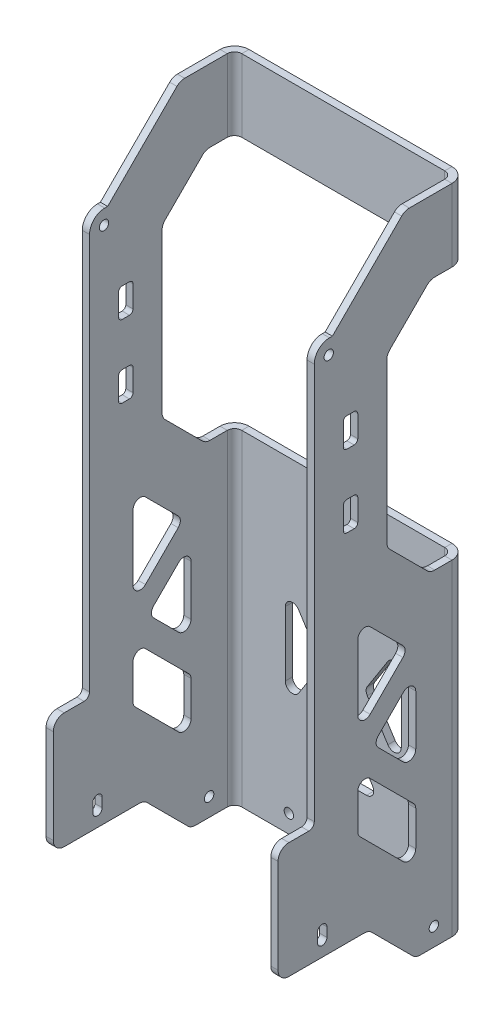
from build123d import *

# Parameters (mm, degrees)
BASE_FLANGE1_DEPTH      = 180
CUT_EXTRUDE2_DEPTH      = 188.584647559
CUT_EXTRUDE2_DEPTH_BACK = 188.584647559
CUT_EXTRUDE3_DEPTH      = 188.584647559
CUT_EXTRUDE3_DEPTH_BACK = 188.584647559
SKETCH9_R               = 1.3
FILLET1_R               = 4.2
SKETCH11_W              = 2
SKETCH11_H              = 32
BOSS_EXTRUDE1_DEPTH     = 10
FILLET5_R               = 3
FILLET6_R               = 1.5
CUT_EXTRUDE4_DEPTH      = 188.584647559
CUT_EXTRUDE4_DEPTH_BACK = 188.584647559
SKETCH13_R              = 1.3
CUT_EXTRUDE5_DEPTH      = 10
CUT_EXTRUDE6_DEPTH      = 188.584647559
CUT_EXTRUDE6_DEPTH_BACK = 188.584647559
SKETCH14_R              = 1.3
CUT_EXTRUDE8_DEPTH      = 188.584647559
CUT_EXTRUDE8_DEPTH_BACK = 188.584647559
SKETCH15_W              = 4
SKETCH15_H              = 8
CUT_EXTRUDE9_DEPTH      = 188.584647559
CUT_EXTRUDE9_DEPTH_BACK = 188.584647559
FILLET7_R               = 2
CUT_EXTRUDE10_DEPTH     = 10
FILLET8_R               = 2
FILLET9_R               = 1


# Sheet-metal steps are written as plain solids
with BuildPart() as part:
    # Sketch1 → Base-Flange1 (new body)
    with BuildSketch(Plane(origin=(0, 0, 0), x_dir=(1, 0, 0), z_dir=(0, 1, 0))):
        with BuildLine():
            Line((-30, 0), (-30, 38))
            ThreePointArc((-30, 38), (-29.414213562, 39.414213562), (-28, 40))
            Line((-28, 40), (28, 40))
            ThreePointArc((28, 40), (29.414213562, 39.414213562), (30, 38))
            Line((30, 38), (30, 0))
            Line((30, 0), (32, 0))
            Line((32, 0), (32, 38))
            ThreePointArc((32, 38), (30.828427125, 40.828427125), (28, 42))
            Line((28, 42), (-28, 42))
            ThreePointArc((-28, 42), (-30.828427125, 40.828427125), (-32, 38))
            Line((-32, 38), (-32, 0))
            Line((-32, 0), (-30, 0))
        make_face()
    extrude(amount=BASE_FLANGE1_DEPTH)

    # Sketch6 → Cut-Extrude2 (cut, two sides: drawn at the far end of the back side and taken through both)
    with BuildSketch(Plane(origin=(0, 0, 0), x_dir=(0, 0, -1), z_dir=(1, 0, 0)).offset(-CUT_EXTRUDE2_DEPTH_BACK)):
        Polygon((0, 13), (15, 13), (28, 0), (0, 0), align=None)
        Polygon((42, 160), (32, 160), (20, 148), (20, 102), (32, 90), (42, 90), align=None)
        Polygon((0, 160), (5, 160), (25, 180), (0, 180), align=None)
    extrude(amount=CUT_EXTRUDE2_DEPTH + CUT_EXTRUDE2_DEPTH_BACK, mode=Mode.SUBTRACT)

    # Sketch9 → Cut-Extrude3 (cut, two sides: drawn at the far end of the back side and taken through both)
    with BuildSketch(Plane(origin=(0, 0, 0), x_dir=(0, 0, -1), z_dir=(1, 0, 0)).offset(-CUT_EXTRUDE3_DEPTH_BACK)):
        with Locations((4, 156)):
            Circle(SKETCH9_R)
    extrude(amount=CUT_EXTRUDE3_DEPTH + CUT_EXTRUDE3_DEPTH_BACK, mode=Mode.SUBTRACT)

    # Fillet1
    fillet1_edges = [part.edges().sort_by_distance(p)[0] for p in [
        (31, 160, 0),
        (-31, 160, 0),
    ]]
    fillet(fillet1_edges, radius=FILLET1_R)

    # Sketch11 → Boss-Extrude1 (add)
    with BuildSketch(Plane.XY):
        with Locations((-31, 29)):
            Rectangle(SKETCH11_W, SKETCH11_H)
        with Locations((31, 29)):
            Rectangle(SKETCH11_W, SKETCH11_H)
    extrude(amount=BOSS_EXTRUDE1_DEPTH)

    # Fillet5
    fillet5_edges = [part.edges().sort_by_distance(p)[0] for p in [
        (-31, 102, -20),
        (-31, 148, -20),
        (-31, 160, -32),
        (31, 180, -25),
        (-31, 0, -28),
        (-31, 13, -15),
        (31, 0, -28),
        (31, 13, -15),
        (-31, 180, -25),
        (-31, 13, 10),
        (-31, 45, 10),
        (31, 13, 10),
        (31, 45, 10),
        (31, 102, -20),
        (31, 148, -20),
        (31, 160, -32),
        (31, 90, -32),
        (-31, 90, -32),
    ]]
    fillet(fillet5_edges, radius=FILLET5_R)

    # Fillet6
    fillet6_edges = [part.edges().sort_by_distance(p)[0] for p in [
        (-31, 45, 0),
        (31, 45, 0),
    ]]
    fillet(fillet6_edges, radius=FILLET6_R)

    # Sketch12 → Cut-Extrude4 (cut, two sides: drawn at the far end of the back side and taken through both)
    with BuildSketch(Plane(origin=(0, 0, 0), x_dir=(0, 0, -1), z_dir=(1, 0, 0)).offset(-CUT_EXTRUDE4_DEPTH_BACK)):
        with BuildLine():
            Line((3.5, 19.6), (3.5, 17.1))
            ThreePointArc((3.5, 17.1), (2.2, 15.8), (0.9, 17.1))
            Line((0.9, 17.1), (0.9, 19.6))
            ThreePointArc((0.9, 19.6), (2.2, 20.9), (3.5, 19.6))
        make_face()
    extrude(amount=CUT_EXTRUDE4_DEPTH + CUT_EXTRUDE4_DEPTH_BACK, mode=Mode.SUBTRACT)

    # Sketch13 → Cut-Extrude5 (cut)
    with BuildSketch(Plane(origin=(0, 0, -42), x_dir=(-1, 0, 0), z_dir=(0, 0, -1))):
        with Locations((-15, 5)):
            Circle(SKETCH13_R)
        with Locations((15, 5)):
            Circle(SKETCH13_R)
    extrude(amount=-CUT_EXTRUDE5_DEPTH, mode=Mode.SUBTRACT)

    # Sketch14 → Cut-Extrude6 (cut, two sides: drawn at the far end of the back side and taken through both)
    with BuildSketch(Plane(origin=(0, 0, 0), x_dir=(0, 0, -1), z_dir=(1, 0, 0)).offset(-CUT_EXTRUDE6_DEPTH_BACK)):
        with Locations((33, 5)):
            Circle(SKETCH14_R)
    extrude(amount=CUT_EXTRUDE6_DEPTH + CUT_EXTRUDE6_DEPTH_BACK, mode=Mode.SUBTRACT)

    # Sketch15 → Cut-Extrude8 (cut, two sides: drawn at the far end of the back side and taken through both)
    with BuildSketch(Plane(origin=(0, 0, 0), x_dir=(0, 0, -1), z_dir=(1, 0, 0)).offset(-CUT_EXTRUDE8_DEPTH_BACK)):
        with Locations((10, 135)):
            Rectangle(SKETCH15_W, SKETCH15_H)
        with Locations((10, 115)):
            Rectangle(SKETCH15_W, SKETCH15_H)
    extrude(amount=CUT_EXTRUDE8_DEPTH + CUT_EXTRUDE8_DEPTH_BACK, mode=Mode.SUBTRACT)

    # Sketch16 → Cut-Extrude9 (cut, two sides: drawn at the far end of the back side and taken through both)
    with BuildSketch(Plane(origin=(0, 0, 0), x_dir=(0, 0, -1), z_dir=(1, 0, 0)).offset(-CUT_EXTRUDE9_DEPTH_BACK)):
        Polygon((25.878679656, 74.908116908), (12, 88.786796564), (12, 61.029437252), align=None)
        Polygon((28, 68.544155877), (16.242640687, 56.786796564), (28, 45.029437252), align=None)
        Polygon((28, 36.544155877), (12, 52.544155877), (12, 37.213203436), (28, 21.213203436), align=None)
    extrude(amount=CUT_EXTRUDE9_DEPTH + CUT_EXTRUDE9_DEPTH_BACK, mode=Mode.SUBTRACT)

    # Fillet7
    fillet7_edges = [part.edges().sort_by_distance(p)[0] for p in [
        (31, 45.029437252, -28),
        (-31, 45.029437252, -28),
        (31, 56.786796564, -16.242640687),
        (-31, 56.786796564, -16.242640687),
        (31, 68.544155877, -28),
        (-31, 68.544155877, -28),
        (31, 52.544155877, -12),
        (-31, 52.544155877, -12),
        (31, 36.544155877, -28),
        (-31, 36.544155877, -28),
        (31, 21.213203436, -28),
        (-31, 21.213203436, -28),
        (31, 37.213203436, -12),
        (-31, 37.213203436, -12),
        (31, 74.908116908, -25.878679656),
        (-31, 74.908116908, -25.878679656),
        (31, 61.029437252, -12),
        (-31, 61.029437252, -12),
        (31, 88.786796564, -12),
        (-31, 88.786796564, -12),
    ]]
    fillet(fillet7_edges, radius=FILLET7_R)

    # Sketch17 → Cut-Extrude10 (cut)
    with BuildSketch(Plane(origin=(0, 0, -42), x_dir=(-1, 0, 0), z_dir=(0, 0, -1))):
        Polygon((-5.936328832, 45), (-16, 60.7244862), (-16, 29.2755138), align=None)
        Polygon((10.063671168, 70), (-10.063671168, 70), (0, 54.2755138), align=None)
        Polygon((16, 60.7244862), (5.936328832, 45), (16, 29.2755138), align=None)
        Polygon((10.063671168, 20), (0, 35.7244862), (-10.063671168, 20), align=None)
    extrude(amount=-CUT_EXTRUDE10_DEPTH, mode=Mode.SUBTRACT)

    # Fillet8
    fillet8_edges = [part.edges().sort_by_distance(p)[0] for p in [
        (10.063671168, 20, -41),
        (0, 35.7244862, -41),
        (-10.063671168, 20, -41),
        (5.936328832, 45, -41),
        (16, 29.2755138, -41),
        (16, 60.7244862, -41),
        (-5.936328832, 45, -41),
        (-16, 60.7244862, -41),
        (-16, 29.2755138, -41),
        (-10.063671168, 70, -41),
        (0, 54.2755138, -41),
        (10.063671168, 70, -41),
    ]]
    fillet(fillet8_edges, radius=FILLET8_R)

    # Fillet9
    fillet9_edges = [part.edges().sort_by_distance(p)[0] for p in [
        (31, 139, -12),
        (-31, 139, -12),
        (31, 131, -12),
        (-31, 131, -12),
        (31, 131, -8),
        (-31, 131, -8),
        (31, 139, -8),
        (-31, 139, -8),
        (31, 119, -12),
        (-31, 119, -12),
        (31, 111, -12),
        (-31, 111, -12),
        (31, 111, -8),
        (-31, 111, -8),
        (31, 119, -8),
        (-31, 119, -8),
    ]]
    fillet(fillet9_edges, radius=FILLET9_R)


solid = part.part
